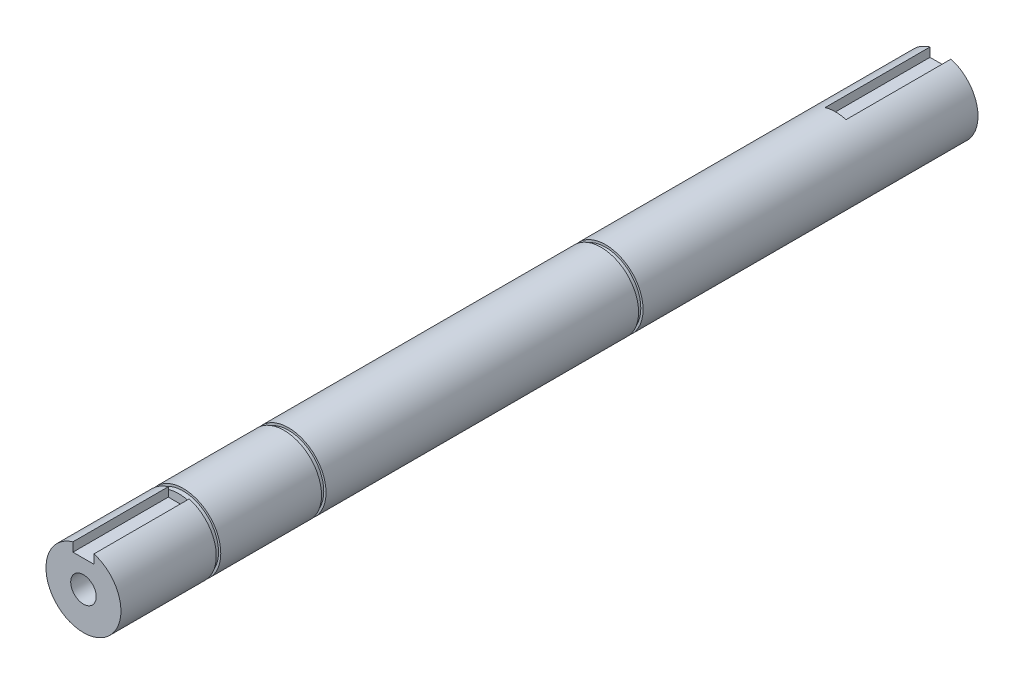
from build123d import *
from OCP.BRepAlgoAPI import BRepAlgoAPI_Cut
from OCP.TopTools import TopTools_ListOfShape

# Parameters (mm, degrees)
EXTRUDE_1_DEPTH        = 5
EXTRUDE_1_DEPTH_BACK   = 280.836309
SKETCH_1_R             = 12.5
HOLE_WIZARD_M101_D     = 8.5
HOLE_WIZARD_M101_DEPTH = 27.5
HOLE_WIZARD_M101_TIP   = 2.553657631
SKETCH_6_W             = 7
SKETCH_6_H             = 7
CUT_EXTRUDE_1_DEPTH    = 35
SKETCH_7_W             = 1.5
SKETCH_7_H             = 2.75
CUT_EXTRUDE_START      = -285.836309
SKETCH_6_2_W           = 7
SKETCH_6_2_H           = 7
CUT_EXTRUDE_2_DEPTH    = 31.8
HOLE_WIZARD_M102_D     = 8.5
HOLE_WIZARD_M102_DEPTH = 27.5
HOLE_WIZARD_M102_TIP   = 2.553657631


with BuildPart() as part:
    # Эскиз1 → Бобышка-Вытянуть1 (new, two sides: drawn at the far end of the back side and taken through both)
    with BuildSketch(Plane.XY.offset(-EXTRUDE_1_DEPTH_BACK)):
        Circle(SKETCH_1_R)
    extrude(amount=EXTRUDE_1_DEPTH + EXTRUDE_1_DEPTH_BACK)

    # Отверстие обработанное метчиком M101
    with Locations(Plane(origin=(0, 0, -280.836309448), x_dir=(-1, 0, 0), z_dir=(0, 0, -1))):
        with Locations((0, 0)):
            Hole(HOLE_WIZARD_M101_D / 2, depth=HOLE_WIZARD_M101_DEPTH)
            with Locations((0, 0, -(HOLE_WIZARD_M101_DEPTH + HOLE_WIZARD_M101_TIP / 2))):  # 118° drill point
                Cone(0, HOLE_WIZARD_M101_D / 2, HOLE_WIZARD_M101_TIP, mode=Mode.SUBTRACT)

    # Эскиз6 → Вырез-Вытянуть1 (cut)
    with BuildSketch(Plane(origin=(0, 0, -280.836309448), x_dir=(-1, 0, 0), z_dir=(0, 0, -1))):
        with Locations((0, 12.5)):
            Rectangle(SKETCH_6_W, SKETCH_6_H)
    extrude(amount=-CUT_EXTRUDE_1_DEPTH, mode=Mode.SUBTRACT)

    # Эскиз7 → Вырез-Повернуть1 (revolve, cut)
    with BuildSketch(Plane(origin=(0, 0, 0), x_dir=(0, 0, -1), z_dir=(1, 0, 0)), mode=Mode.PRIVATE) as cut_revolve_1_sk:
        with Locations((62.65, 13.125)):
            Rectangle(SKETCH_7_W, SKETCH_7_H)
        with Locations((27.55, 13.125)):
            Rectangle(SKETCH_7_W, SKETCH_7_H)
        with Locations((168.386309448, 13.125)):
            Rectangle(SKETCH_7_W, SKETCH_7_H)
    revolve(cut_revolve_1_sk.sketch.rotate(Axis((0, 0, 1000), (0, 0, -1)), 90), axis=Axis((0, 0, 1000), (0, 0, -1)), mode=Mode.SUBTRACT)


with BuildPart() as cut_extrude_2_tool:
    # Эскиз6<2> → Вырез-Вытянуть2 (new body)
    with BuildSketch(Plane(origin=(0, 0, -280.836309448), x_dir=(-1, 0, 0), z_dir=(0, 0, -1)).offset(CUT_EXTRUDE_START)):
        with Locations((0, 12.5)):
            Rectangle(SKETCH_6_2_W, SKETCH_6_2_H)
    extrude(amount=CUT_EXTRUDE_2_DEPTH)


with BuildPart() as part_1:
    add(part.part)

    # Вырез-Вытянуть2: cut by cut_extrude_2_tool, with a tolerance
    cut_extrude_2_stock = TopTools_ListOfShape()
    cut_extrude_2_stock.Append(part_1.part.wrapped)
    cut_extrude_2_tools = TopTools_ListOfShape()
    cut_extrude_2_tools.Append(cut_extrude_2_tool.part.wrapped)
    cut_extrude_2_cut = BRepAlgoAPI_Cut()
    cut_extrude_2_cut.SetArguments(cut_extrude_2_stock)
    cut_extrude_2_cut.SetTools(cut_extrude_2_tools)
    cut_extrude_2_cut.SetFuzzyValue(0.00001)
    cut_extrude_2_cut.Build()
    add(Compound.cast(cut_extrude_2_cut.Shape()).solids(), mode=Mode.REPLACE)

    # Отверстие обработанное метчиком M102
    with Locations(Plane.XY.offset(5)):
        with Locations((0, 0)):
            Hole(HOLE_WIZARD_M102_D / 2, depth=HOLE_WIZARD_M102_DEPTH)
            with Locations((0, 0, -(HOLE_WIZARD_M102_DEPTH + HOLE_WIZARD_M102_TIP / 2))):  # 118° drill point
                Cone(0, HOLE_WIZARD_M102_D / 2, HOLE_WIZARD_M102_TIP, mode=Mode.SUBTRACT)


solid = part_1.part
